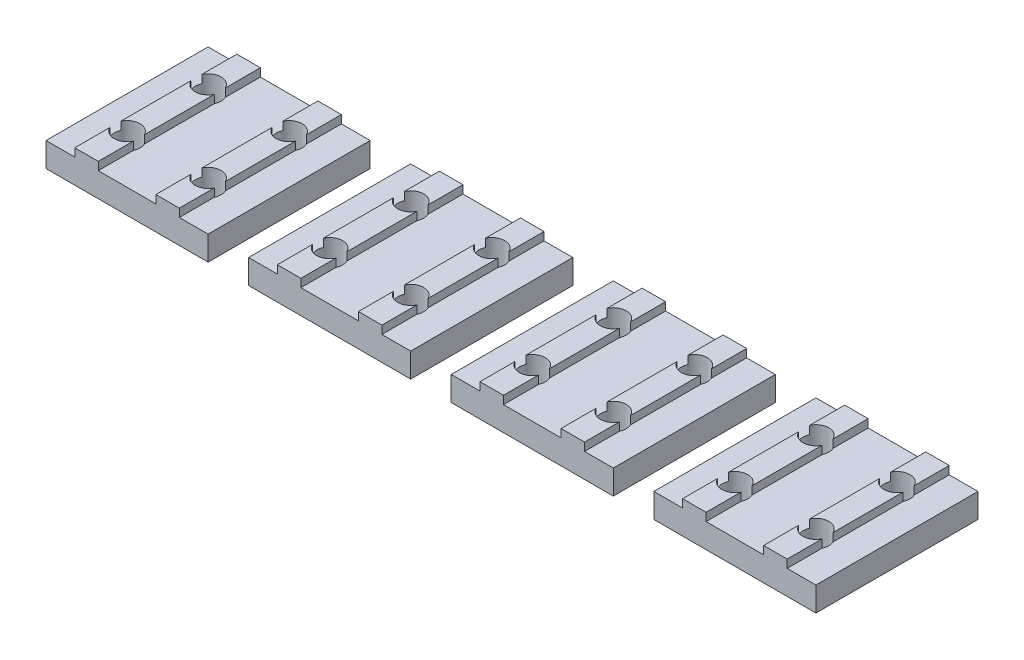
from build123d import *

# Parameters (mm, degrees)
MAIN_DEPTH                 = 20
ESQUISSE2_R                = 1.6
TOPHOLE_DEPTH              = 22
R_P_TITION_LIN_AIRE1_COUNT = 2
R_P_TITION_LIN_AIRE1_PITCH = 10
R_P_TITION_LIN_AIRE2_COUNT = 4
R_P_TITION_LIN_AIRE2_PITCH = 25


with BuildPart() as part:
    # Esquisse1 → Main (new body)
    with BuildSketch(Plane.XY):
        Polygon((-5, 0), (-5, 3), (-1.45, 3), (-1.45, 4), (1.45, 4), (1.45, 3), (5, 3), (5, 0), align=None)
    main = extrude(amount=MAIN_DEPTH)

    # Esquisse2 → TopHole (cut, through all)
    with BuildSketch(Plane(origin=(0, 4, 0), x_dir=(1, 0, 0), z_dir=(0, 1, 0))):
        with Locations((0, -5)):
            Circle(ESQUISSE2_R)
        with Locations((0, -15)):
            Circle(ESQUISSE2_R)
    tophole = extrude(amount=-TOPHOLE_DEPTH, mode=Mode.SUBTRACT)

    # Répétition linéaire1: Main, TopHole ×2
    with Locations(*[(-i * R_P_TITION_LIN_AIRE1_PITCH, 0, 0) for i in range(1, R_P_TITION_LIN_AIRE1_COUNT)]):
        add(main)
        add(tophole, mode=Mode.SUBTRACT)


with BuildPart() as r_p_tition_lin_aire2_1:
    # Répétition linéaire2: pattern copy
    add(part.part.moved(Location(Vector(-1, 0, 0) * (1 * R_P_TITION_LIN_AIRE2_PITCH))))


with BuildPart() as r_p_tition_lin_aire2_2:
    # Répétition linéaire2: pattern copy
    add(part.part.moved(Location(Vector(-1, 0, 0) * (2 * R_P_TITION_LIN_AIRE2_PITCH))))


with BuildPart() as r_p_tition_lin_aire2_3:
    # Répétition linéaire2: pattern copy
    add(part.part.moved(Location(Vector(-1, 0, 0) * (3 * R_P_TITION_LIN_AIRE2_PITCH))))


solid = Compound([part.part, r_p_tition_lin_aire2_1.part, r_p_tition_lin_aire2_2.part, r_p_tition_lin_aire2_3.part])
